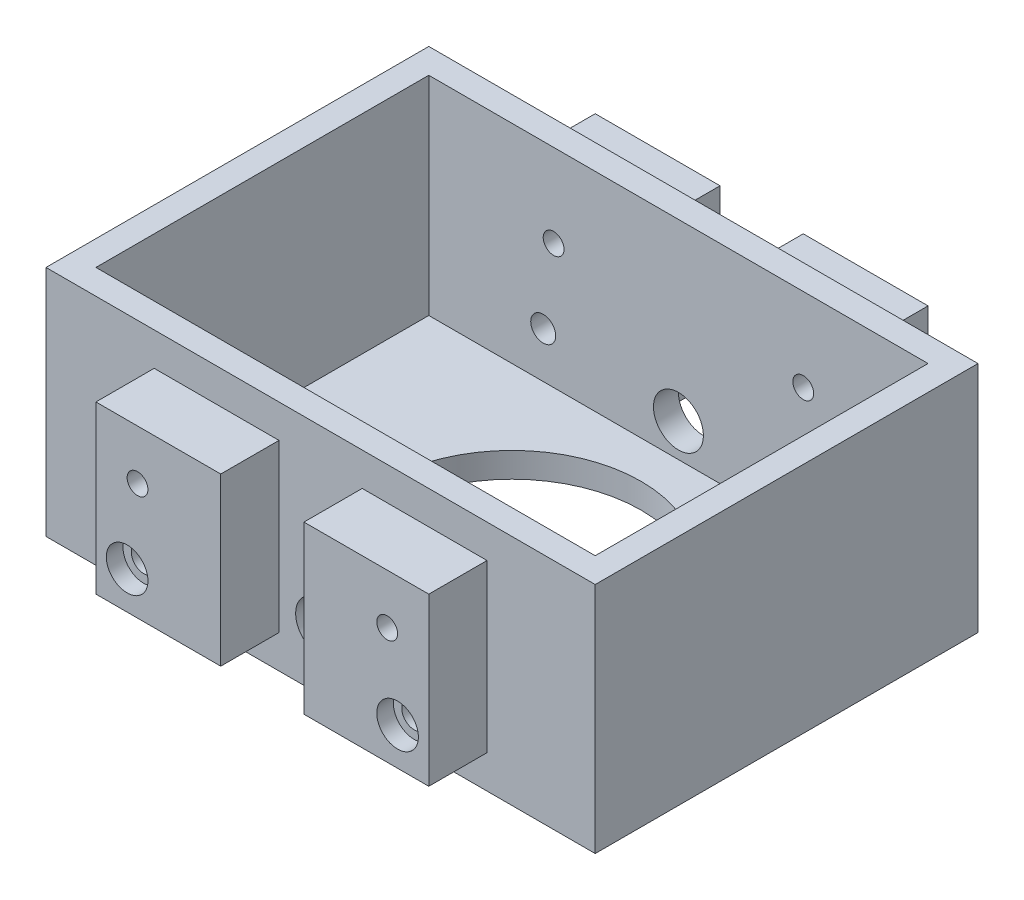
from build123d import *

# Parameters (mm, degrees)
SKETCH1_W               = 66
SKETCH1_H               = 46
BOSS_EXTRUDE2_DEPTH     = 3
SKETCH3_W               = 66
SKETCH3_H               = 46
SKETCH3_W_2             = 60
SKETCH3_H_2             = 40
BOSS_EXTRUDE4_DEPTH     = 25
SKETCH4_W               = 15
SKETCH4_H               = 20
BOSS_EXTRUDE5_DEPTH     = 7
CUT_EXTRUDE1_REACH      = 74.806
SKETCH5_R               = 1.5
SKETCH5_R_2             = 1.25
SKETCH6_W               = 15
SKETCH6_H               = 20
BOSS_EXTRUDE6_DEPTH     = 7
CUT_EXTRUDE2_START      = -10
SKETCH7_R               = 1.5
SKETCH7_R_2             = 1.25
CUT_EXTRUDE2_DEPTH      = 10
CUT_EXTRUDE3_REACH      = 71.125
SKETCH8_R               = 15.5
SKETCH9_R               = 2.5
CUT_EXTRUDE4_DEPTH      = 2
CUT_EXTRUDE5_START      = -2
SKETCH10_R              = 2.5
CUT_EXTRUDE5_DEPTH      = 2
CUT_EXTRUDE6_DEPTH      = 73.806070335
CUT_EXTRUDE6_DEPTH_BACK = 73.806070335
SKETCH11_R              = 3


with BuildPart() as part:
    # Sketch1 → Boss-Extrude2 (new body)
    with BuildSketch(Plane(origin=(0, 0, 0), x_dir=(1, 0, 0), z_dir=(0, 1, 0))):
        with Locations((-8.324615879, -17.817795916)):
            Rectangle(SKETCH1_W, SKETCH1_H)
    extrude(amount=BOSS_EXTRUDE2_DEPTH)

    # Sketch3 → Boss-Extrude4 (add)
    with BuildSketch(Plane(origin=(0, 3, 0), x_dir=(1, 0, 0), z_dir=(0, 1, 0))):
        with Locations((-8.324615879, -17.817795916)):
            Rectangle(SKETCH3_W, SKETCH3_H)
        with Locations((-8.324615879, -17.817795916)):
            Rectangle(SKETCH3_W_2, SKETCH3_H_2, mode=Mode.SUBTRACT)
    extrude(amount=BOSS_EXTRUDE4_DEPTH)

    # Sketch4 → Boss-Extrude5 (add)
    with BuildSketch(Plane.XY.offset(40.817795916)):
        with Locations((-20.824615879, 14)):
            Rectangle(SKETCH4_W, SKETCH4_H)
        with Locations((4.175384121, 14)):
            Rectangle(SKETCH4_W, SKETCH4_H)
    extrude(amount=BOSS_EXTRUDE5_DEPTH)

    # Sketch5 → Cut-Extrude1 (cut, up to next)
    with BuildSketch(Plane.XY.offset(47.817795916), mode=Mode.PRIVATE) as cut_extrude1_sk1:
        with Locations((-24.574615879, 8.5)):
            Circle(SKETCH5_R)
    cut_extrude1_tool1 = extrude(cut_extrude1_sk1.sketch, amount=-CUT_EXTRUDE1_REACH, mode=Mode.PRIVATE) & part.part
    # Sketch5 → Cut-Extrude1 (cut, up to next)
    with BuildSketch(Plane.XY.offset(47.817795916), mode=Mode.PRIVATE) as cut_extrude1_sk2:
        with Locations((7.925384121, 8.5)):
            Circle(SKETCH5_R)
    cut_extrude1_tool2 = extrude(cut_extrude1_sk2.sketch, amount=-CUT_EXTRUDE1_REACH, mode=Mode.PRIVATE) & part.part
    # Sketch5 → Cut-Extrude1 (cut, up to next)
    with BuildSketch(Plane.XY.offset(47.817795916), mode=Mode.PRIVATE) as cut_extrude1_sk3:
        with Locations((6.675384121, 18)):
            Circle(SKETCH5_R_2)
    cut_extrude1_tool3 = extrude(cut_extrude1_sk3.sketch, amount=-CUT_EXTRUDE1_REACH, mode=Mode.PRIVATE) & part.part
    # Sketch5 → Cut-Extrude1 (cut, up to next)
    with BuildSketch(Plane.XY.offset(47.817795916), mode=Mode.PRIVATE) as cut_extrude1_sk4:
        with Locations((-23.324615879, 18)):
            Circle(SKETCH5_R_2)
    cut_extrude1_tool4 = extrude(cut_extrude1_sk4.sketch, amount=-CUT_EXTRUDE1_REACH, mode=Mode.PRIVATE) & part.part
    add(cut_extrude1_tool1.solids().sort_by_distance((-24.574616, 8.5, 47.817796))[0], mode=Mode.SUBTRACT)
    add(cut_extrude1_tool2.solids().sort_by_distance((7.925384, 8.5, 47.817796))[0], mode=Mode.SUBTRACT)
    add(cut_extrude1_tool3.solids().sort_by_distance((6.675384, 18, 47.817796))[0], mode=Mode.SUBTRACT)
    add(cut_extrude1_tool4.solids().sort_by_distance((-23.324616, 18, 47.817796))[0], mode=Mode.SUBTRACT)

    # Sketch6 → Boss-Extrude6 (add)
    with BuildSketch(Plane(origin=(0, 0, -5.182204084), x_dir=(-1, 0, 0), z_dir=(0, 0, -1))):
        with Locations((-4.175384121, 14)):
            Rectangle(SKETCH6_W, SKETCH6_H)
        with Locations((20.824615879, 14)):
            Rectangle(SKETCH6_W, SKETCH6_H)
    extrude(amount=BOSS_EXTRUDE6_DEPTH)

    # Sketch7 → Cut-Extrude2 (cut)
    with BuildSketch(Plane(origin=(0, 0, -12.182204084), x_dir=(-1, 0, 0), z_dir=(0, 0, -1)).offset(CUT_EXTRUDE2_START)):
        with Locations((-7.925384121, 8.5)):
            Circle(SKETCH7_R)
        with Locations((24.574615879, 8.5)):
            Circle(SKETCH7_R)
        with Locations((23.324615879, 18)):
            Circle(SKETCH7_R_2)
        with Locations((-6.675384121, 18)):
            Circle(SKETCH7_R_2)
    extrude(amount=CUT_EXTRUDE2_DEPTH, mode=Mode.SUBTRACT)

    # Sketch8 → Cut-Extrude3 (cut, up to next)
    with BuildSketch(Plane(origin=(0, 0, 0), x_dir=(-1, 0, 0), z_dir=(0, -1, 0)), mode=Mode.PRIVATE) as cut_extrude3_sk1:
        with Locations((8.324615879, -17.817795916)):
            Circle(SKETCH8_R)
    cut_extrude3_tool1 = extrude(cut_extrude3_sk1.sketch, amount=-CUT_EXTRUDE3_REACH, mode=Mode.PRIVATE) & part.part
    add(cut_extrude3_tool1.solids().sort_by_distance((-8.324616, 0, 17.817796))[0], mode=Mode.SUBTRACT)

    # Sketch9 → Cut-Extrude4 (cut)
    with BuildSketch(Plane(origin=(0, 0, -12.182204084), x_dir=(-1, 0, 0), z_dir=(0, 0, -1))):
        with Locations((-7.925384121, 8.5)):
            Circle(SKETCH9_R)
        with Locations((24.574615879, 8.5)):
            Circle(SKETCH9_R)
    extrude(amount=-CUT_EXTRUDE4_DEPTH, mode=Mode.SUBTRACT)

    # Sketch10 → Cut-Extrude5 (cut)
    with BuildSketch(Plane.XY.offset(47.817795916).offset(CUT_EXTRUDE5_START)):
        with Locations((-24.574615879, 8.5)):
            Circle(SKETCH10_R)
        with Locations((7.925384121, 8.5)):
            Circle(SKETCH10_R)
    extrude(amount=CUT_EXTRUDE5_DEPTH, mode=Mode.SUBTRACT)

    # Sketch11 → Cut-Extrude6 (cut, two sides: drawn at the far end of the back side and taken through both)
    with BuildSketch(Plane.XY.offset(40.817795916).offset(-CUT_EXTRUDE6_DEPTH_BACK)):
        with Locations((-8.324615879, 7)):
            Circle(SKETCH11_R)
    extrude(amount=CUT_EXTRUDE6_DEPTH + CUT_EXTRUDE6_DEPTH_BACK, mode=Mode.SUBTRACT)


solid = part.part
